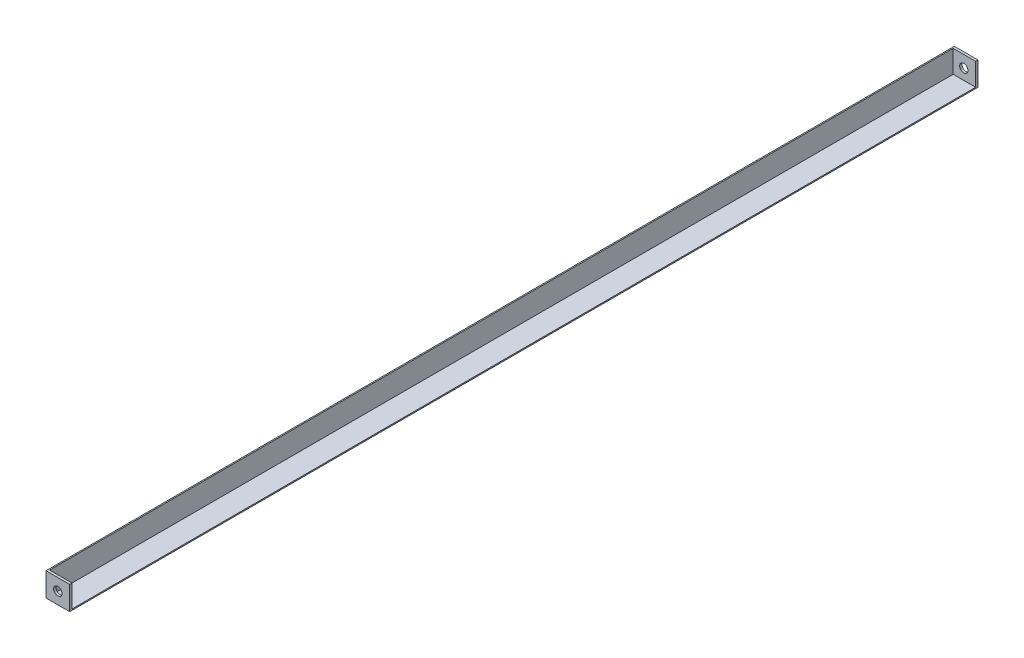
from build123d import *

# Parameters (mm, degrees)
BOSS_EXTRUDE1_DEPTH = 609.6
BOSS_EXTRUDE2_START = 609.6
SKETCH2_W           = 31.75
SKETCH2_H           = 31.75
SKETCH2_R           = 5.588
BOSS_EXTRUDE2_DEPTH = 3.175


with BuildPart() as part:
    # Sketch1 → Boss-Extrude1 (new, symmetric)
    with BuildSketch(Plane.XY):
        Polygon((31.75, 1.5875), (1.5875, 1.5875), (1.5875, 31.75), (0, 31.75), (0, 0), (31.75, 0), align=None)
    extrude(amount=BOSS_EXTRUDE1_DEPTH, both=True)

    # Sketch2 → Boss-Extrude2 (add)
    with BuildSketch(Plane.XY.offset(BOSS_EXTRUDE2_START)):
        with Locations((15.875, 15.875)):
            Rectangle(SKETCH2_W, SKETCH2_H)
        with Locations((15.875, 15.875)):
            Circle(SKETCH2_R, mode=Mode.SUBTRACT)
    boss_extrude2 = extrude(amount=-BOSS_EXTRUDE2_DEPTH)

    # Mirror1: Boss-Extrude2 across plane
    add(boss_extrude2.mirror(Plane.XY))


solid = part.part
